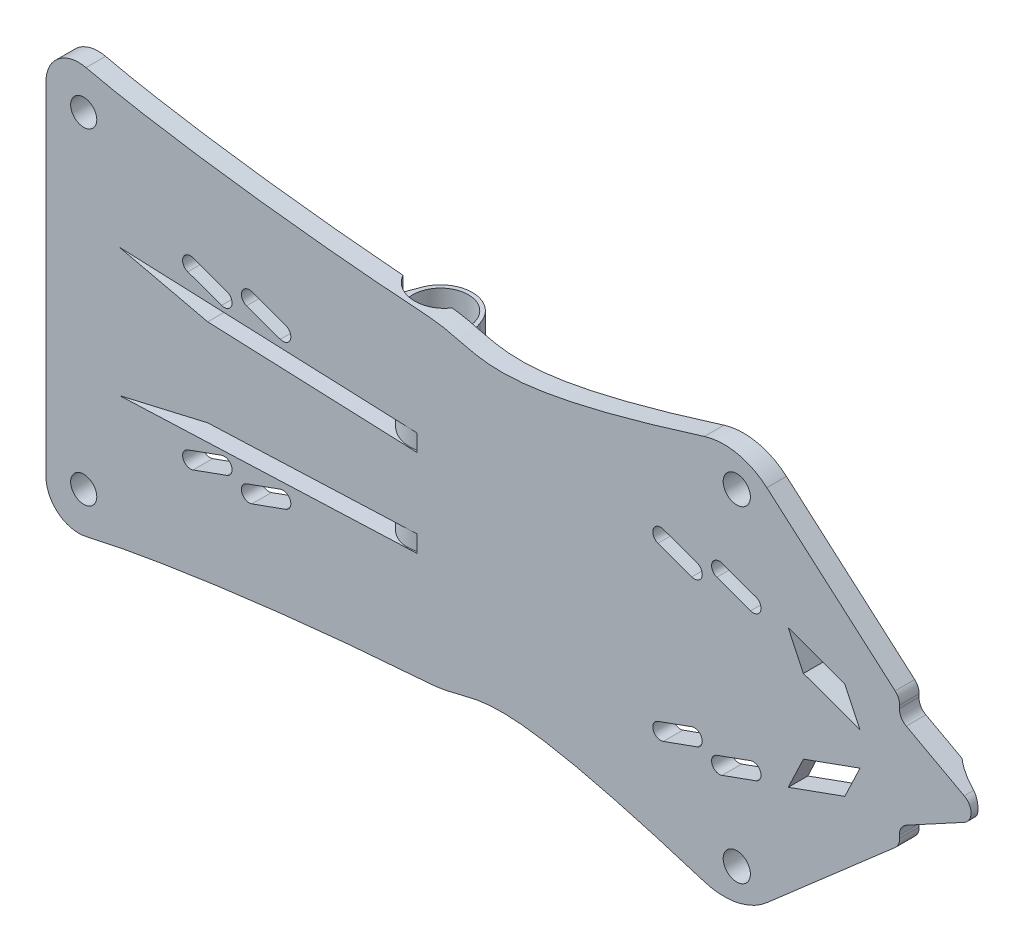
from build123d import *

# Parameters (mm, degrees)
SKETCH3_R                = 2.082096389
SKETCH3_R_2              = 2
BOSS_EXTRUDE1_DEPTH      = 3
CUT_EXTRUDE1_DEPTH       = 91.44915515
CUT_EXTRUDE3_DEPTH       = 91.44915515
CUT_EXTRUDE3_DEPTH_BACK  = 91.44915515
SKETCH8_R                = 4.25
BOSS_EXTRUDE2_DEPTH      = 1
BOSS_EXTRUDE2_DEPTH_BACK = 23
BOSS_EXTRUDE2_START      = -45
SKETCH9_R                = 5
SKETCH9_R_2              = 4.25
CHAMFER2_DEPTH           = 11.18578846
CHAMFER2_START           = -12.81421154
CHAMFER2_2_DEPTH         = 12.81421154
CHAMFER2_START_2         = -1.013840203
CHAMFER2_3_DEPTH         = 1.013840203
CUT_EXTRUDE4_DEPTH       = 91.694641904
CUT_EXTRUDE4_DEPTH_BACK  = 91.694641904
SKETCH10_R               = 4.25
SKETCH11_R               = 4.859724043
SKETCH11_R_2             = 4.25
BOSS_EXTRUDE3_DEPTH      = 21
CHAMFER3_SIZE            = 1.511790084
CUT_EXTRUDE5_DEPTH       = 103.781219255
CUT_EXTRUDE5_DEPTH_BACK  = 103.781219255
SKETCH12_R               = 4.25


with BuildPart() as part:
    # Sketch3 → Boss-Extrude1 (new body)
    with BuildSketch(Plane.XY):
        with BuildLine():
            Line((53.567335457, -27.517277185), (73.205575811, -10.388630143))
            ThreePointArc((73.205575811, -10.388630143), (73.719795761, -9.686550842), (73.883615194, -8.831857508))
            Line((73.883615194, -8.831857508), (73.869489232, -8.39082312))
            ThreePointArc((73.869489232, -8.39082312), (74.133881529, -7.331195739), (74.915488843, -6.568435304))
            Line((74.915488843, -6.568435304), (83.790693699, -1.758362323))
            ThreePointArc((83.790693699, -1.758362323), (84.837718389, 0), (83.790693699, 1.758362323))
            Line((83.790693699, 1.758362323), (74.915488843, 6.568435304))
            ThreePointArc((74.915488843, 6.568435304), (74.133881529, 7.331195739), (73.869489232, 8.39082312))
            Line((73.869489232, 8.39082312), (73.883615194, 8.831857508))
            ThreePointArc((73.883615194, 8.831857508), (73.719795761, 9.686550842), (73.205575811, 10.388630143))
            Line((73.205575811, 10.388630143), (53.567335457, 27.517277185))
            ThreePointArc((53.567335457, 27.517277185), (49.04018756, 29.769557014), (43.989927812, 29.519139381))
            add(Edge.make_bspline(
                [(43.989927812, 29.519139381), (11.417328412, 19.259455683), (10.016864662, 23.93436223), (-9.743436757, 24.953195317), (-36.823512678, 27.880918184), (-50.686624463, 31.089958986)],
                knots=[0.053265799, 0.053265799, 0.053265799, 0.053265799, 0.401148982, 0.486692618, 0.908702153, 0.908702153, 0.908702153, 0.908702153], degree=3))
            ThreePointArc((-50.686624463, 31.089958986), (-54.925647271, 30.132708588), (-56.81421154, 26.218763303))
            Line((-56.81421154, 26.218763303), (-56.81421154, -26.218763303))
            ThreePointArc((-56.81421154, -26.218763303), (-54.925647271, -30.132708588), (-50.686624463, -31.089958986))
            add(Edge.make_bspline(
                [(43.989927812, -29.519139381), (11.417328412, -19.259455683), (10.016864662, -23.93436223), (-9.743436757, -24.953195317), (-36.823512678, -27.880918184), (-50.686624463, -31.089958986)],
                knots=[0.053265799, 0.053265799, 0.053265799, 0.053265799, 0.401148982, 0.486692618, 0.908702153, 0.908702153, 0.908702153, 0.908702153], degree=3))
            ThreePointArc((43.989927812, -29.519139381), (49.04018756, -29.769557014), (53.567335457, -27.517277185))
        make_face()
        with Locations((48.961511901, -25)):
            Circle(SKETCH3_R, mode=Mode.SUBTRACT)
        with Locations((-51.038488099, -25)):
            Circle(SKETCH3_R_2, mode=Mode.SUBTRACT)
        with Locations(Location((-51.038488099, 25, 0), (0, 0, 180))):
            Circle(SKETCH3_R_2, mode=Mode.SUBTRACT)
        with Locations(Location((48.961511901, 25, 0), (0, 0, 180))):
            Circle(SKETCH3_R, mode=Mode.SUBTRACT)
    extrude(amount=BOSS_EXTRUDE1_DEPTH)

    # Sketch4 → Cut-Extrude1 (cut, through all)
    with BuildSketch(Plane(origin=(0, 0, 0), x_dir=(-1, 0, 0), z_dir=(0, 0, -1))):
        with BuildLine():
            Line((-51.884820891, 12.19457593), (-46.711815918, 14.062735331))
            ThreePointArc((-46.711815918, 14.062735331), (-45.175561872, 13.341678115), (-45.896619088, 11.80542407))
            Line((-45.896619088, 11.80542407), (-51.069624062, 9.937264669))
            ThreePointArc((-51.069624062, 9.937264669), (-52.605878107, 10.658321885), (-51.884820891, 12.19457593))
        make_face()
        with BuildLine():
            Line((-42.884820891, 12.19457593), (-37.711815918, 14.062735331))
            ThreePointArc((-37.711815918, 14.062735331), (-36.175561872, 13.341678115), (-36.896619088, 11.80542407))
            Line((-36.896619088, 11.80542407), (-42.069624062, 9.937264669))
            ThreePointArc((-42.069624062, 9.937264669), (-43.605878107, 10.658321885), (-42.884820891, 12.19457593))
        make_face()
        Polygon((0, 7.98580084), (0, 5.397184464), (32.044292121, 6.696314385), (45.586397871, 9.833950684), align=None)
        Polygon((0, -5.397184464), (32.044292121, -6.696314385), (45.586397871, -9.833950684), (0, -7.98580084), align=None)
        with BuildLine():
            Line((20.115179109, 12.19457593), (25.288184082, 14.062735331))
            ThreePointArc((25.288184082, 14.062735331), (26.824438128, 13.341678115), (26.103380912, 11.80542407))
            Line((26.103380912, 11.80542407), (20.930375938, 9.937264669))
            ThreePointArc((20.930375938, 9.937264669), (19.394121893, 10.658321885), (20.115179109, 12.19457593))
        make_face()
        with BuildLine():
            Line((29.115179109, 12.19457593), (34.288184082, 14.062735331))
            ThreePointArc((34.288184082, 14.062735331), (35.824438128, 13.341678115), (35.103380912, 11.80542407))
            Line((35.103380912, 11.80542407), (29.930375938, 9.937264669))
            ThreePointArc((29.930375938, 9.937264669), (28.394121893, 10.658321885), (29.115179109, 12.19457593))
        make_face()
        with BuildLine():
            Line((29.115179109, -12.19457593), (34.288184082, -14.062735331))
            ThreePointArc((34.288184082, -14.062735331), (35.824438128, -13.341678115), (35.103380912, -11.80542407))
            Line((35.103380912, -11.80542407), (29.930375938, -9.937264669))
            ThreePointArc((29.930375938, -9.937264669), (28.394121893, -10.658321885), (29.115179109, -12.19457593))
        make_face()
        with BuildLine():
            Line((20.115179109, -12.19457593), (25.288184082, -14.062735331))
            ThreePointArc((25.288184082, -14.062735331), (26.824438128, -13.341678115), (26.103380912, -11.80542407))
            Line((26.103380912, -11.80542407), (20.930375938, -9.937264669))
            ThreePointArc((20.930375938, -9.937264669), (19.394121893, -10.658321885), (20.115179109, -12.19457593))
        make_face()
        with BuildLine():
            Line((-42.884820891, -12.19457593), (-37.711815918, -14.062735331))
            ThreePointArc((-37.711815918, -14.062735331), (-36.175561872, -13.341678115), (-36.896619088, -11.80542407))
            Line((-36.896619088, -11.80542407), (-42.069624062, -9.937264669))
            ThreePointArc((-42.069624062, -9.937264669), (-43.605878107, -10.658321885), (-42.884820891, -12.19457593))
        make_face()
        with BuildLine():
            Line((-51.884820891, -12.19457593), (-46.711815918, -14.062735331))
            ThreePointArc((-46.711815918, -14.062735331), (-45.175561872, -13.341678115), (-45.896619088, -11.80542407))
            Line((-45.896619088, -11.80542407), (-51.069624062, -9.937264669))
            ThreePointArc((-51.069624062, -9.937264669), (-52.605878107, -10.658321885), (-51.884820891, -12.19457593))
        make_face()
        Polygon((-67.829387279, 2.551083632), (-59.169760244, 5.678388502), (-56.845099744, 10.576922623), (-65.504726778, 7.449617752), align=None)
        Polygon((-59.169760244, -5.678388502), (-56.845099744, -10.576922623), (-65.504726778, -7.449617752), (-67.829387279, -2.551083632), align=None)
    extrude(amount=-CUT_EXTRUDE1_DEPTH, mode=Mode.SUBTRACT)

    # Sketch8 → Cut-Extrude3 (cut, two sides: drawn at the far end of the back side and taken through both)
    with BuildSketch(Plane(origin=(0, 0, 0), x_dir=(0, 0, -1), z_dir=(1, 0, 0)).offset(-CUT_EXTRUDE3_DEPTH_BACK)):
        with Locations((2.312209188, 0)):
            Circle(SKETCH8_R)
    extrude(amount=CUT_EXTRUDE3_DEPTH + CUT_EXTRUDE3_DEPTH_BACK, mode=Mode.SUBTRACT)

    # Sketch9 → Boss-Extrude2 (add, two sides: drawn at the far end of the back side and taken through both)
    with BuildSketch(Plane.ZY.offset(56.81421154).offset(BOSS_EXTRUDE2_START - BOSS_EXTRUDE2_DEPTH_BACK)):
        with Locations((-2.312209188, 0)):
            Circle(SKETCH9_R)
        with Locations(Location((-2.312209188, 0, 0), (0, 0, 57.040285371))):
            Circle(SKETCH9_R_2, mode=Mode.SUBTRACT)
    extrude(amount=BOSS_EXTRUDE2_DEPTH + BOSS_EXTRUDE2_DEPTH_BACK)

    # Chamfer2: read off the stored shape, not the designer's step
    # Chamfer2 outline → Chamfer2 (add)
    with BuildSketch(Plane.YZ):
        with BuildLine():
            ThreePointArc((4.433248095, 0), (4.658527542, -0.496136189), (4.828481954, -1.013840203))
            Line((4.828481954, -1.013840203), (6.26010675, 0))
            Line((6.26010675, 0), (4.433248095, 0))
        make_face()
        with BuildLine():
            Line((-6.26010675, 0), (-4.828481954, -1.013840203))
            ThreePointArc((-4.828481954, -1.013840203), (-4.658527542, -0.496136189), (-4.433248095, 0))
            Line((-4.433248095, 0), (-6.26010675, 0))
        make_face()
    extrude(amount=CHAMFER2_DEPTH)

    # Chamfer2 2 outline → Chamfer2 2 (add)
    with BuildSketch(Plane.YZ.offset(CHAMFER2_START)):
        with BuildLine():
            ThreePointArc((4.433248095, 0), (4.658527542, -0.496136189), (4.828481954, -1.013840203))
            Line((4.828481954, -1.013840203), (6.26010675, 0))
            Line((6.26010675, 0), (4.433248095, 0))
        make_face()
        with BuildLine():
            Line((-6.26010675, 0), (-4.828481954, -1.013840203))
            ThreePointArc((-4.828481954, -1.013840203), (-4.658527542, -0.496136189), (-4.433248095, 0))
            Line((-4.433248095, 0), (-6.26010675, 0))
        make_face()
    extrude(amount=CHAMFER2_2_DEPTH)

    # Chamfer2 3 outline → Chamfer2 3 (cut)
    with BuildSketch(Plane.XY.offset(CHAMFER2_START_2)):
        Polygon((-14, 8), (-14, 5.964768195), (0, 5.397184464), (0, 8), align=None)
        Polygon((0, -5.397184464), (-14, -5.964768195), (-14, -8), (0, -8), align=None)
    extrude(amount=CHAMFER2_3_DEPTH, mode=Mode.SUBTRACT)

    # Sketch10 → Cut-Extrude4 (cut, two sides: drawn at the far end of the back side and taken through both)
    with BuildSketch(Plane(origin=(0, 0, 0), x_dir=(1, 0, 0), z_dir=(0, 1, 0)).offset(-CUT_EXTRUDE4_DEPTH_BACK)):
        with Locations(Location((-1.4, 2, 0), (0, 0, 289.233075902))):
            Circle(SKETCH10_R)
    extrude(amount=CUT_EXTRUDE4_DEPTH + CUT_EXTRUDE4_DEPTH_BACK, mode=Mode.SUBTRACT)

    # Sketch11 → Boss-Extrude3 (add, symmetric)
    with BuildSketch(Plane(origin=(0, 0, 0), x_dir=(1, 0, 0), z_dir=(0, 1, 0))):
        with Locations((-1.4, 2)):
            Circle(SKETCH11_R)
        with Locations(Location((-1.4, 2, 0), (0, 0, 331.927513064))):
            Circle(SKETCH11_R_2, mode=Mode.SUBTRACT)
    extrude(amount=BOSS_EXTRUDE3_DEPTH, both=True)

    # Chamfer3
    # the kernel refuses this chamfer: 2, 1.511790084 mm, written as the material it adds along each edge
    with BuildSketch(Plane(origin=(3.02909898, -2.527492817, 0), x_dir=(1, 0, 0), z_dir=(0, 1, 0))) as chamfer3_piece_1_section:
        with BuildLine():
            Line((CHAMFER3_SIZE, 0), (0.213833892, 3.435302101))
            ThreePointArc((0.213833892, 3.435302101), (0.423511684, 1.737154949), (0, 0))
            Line((0, 0), (CHAMFER3_SIZE, 0))
        make_face()
    chamfer3_piece_1 = extrude(amount=23.527492817, mode=Mode.PRIVATE)
    chamfer3_piece_1 = chamfer3_piece_1 - Plane(origin=(3.02909898, 0, -2.312209188), x_dir=(0, 0, -1), z_dir=(1, 0, 0)) * Cylinder(4.25, 61, mode=Mode.PRIVATE)
    add(chamfer3_piece_1)
    with BuildSketch(Plane(origin=(3.02909898, -21, 0), x_dir=(0.062125783639432115, 0, -0.9980683278248972), z_dir=(0, 1, 0))) as chamfer3_piece_2_section:
        with BuildLine():
            Line((3.441950821, 0), (CHAMFER3_SIZE * 0.0621257836336, -CHAMFER3_SIZE * 0.998068327732))
            Line((CHAMFER3_SIZE * 0.0621257836336, -CHAMFER3_SIZE * 0.998068327732), (0, 0))
            ThreePointArc((0, 0), (1.76011033, -0.314771485), (3.441950821, 0))
        make_face()
    chamfer3_piece_2 = extrude(amount=23.527492817, mode=Mode.PRIVATE)
    chamfer3_piece_2 = chamfer3_piece_2 - Plane(origin=(3.02909898, 0, -2.312209188), x_dir=(0, 0, -1), z_dir=(1, 0, 0)) * Cylinder(4.25, 61, mode=Mode.PRIVATE)
    add(chamfer3_piece_2)
    with BuildSketch(Plane(origin=(-5.82909898, -21, 0), x_dir=(-0.06212578363943492, 0, -0.998068327824897), z_dir=(0, 1, 0))) as chamfer3_piece_3_section:
        with BuildLine():
            Line((3.441950821, 0), (CHAMFER3_SIZE * 0.0621257836336, CHAMFER3_SIZE * 0.998068327732))
            Line((CHAMFER3_SIZE * 0.0621257836336, CHAMFER3_SIZE * 0.998068327732), (0, 0))
            ThreePointArc((0, 0), (1.76011033, 0.314771485), (3.441950821, 0))
        make_face()
    chamfer3_piece_3 = extrude(amount=21.565477174, mode=Mode.PRIVATE)
    chamfer3_piece_3 = split(chamfer3_piece_3, bisect_by=Plane(origin=(-6.346285735, -8.243090021, 0), z_dir=(0.0405084183735224, -0.9991791971617883, 0)), keep=Keep.TOP, mode=Mode.PRIVATE)
    add(chamfer3_piece_3)
    with BuildSketch(Plane(origin=(-5.82909898, -0.565477174, 0), x_dir=(-1, 0, 0), z_dir=(0, 1, 0))) as chamfer3_piece_4_section:
        with BuildLine():
            Line((CHAMFER3_SIZE, 0), (0.213833892, -3.435302101))
            ThreePointArc((0.213833892, -3.435302101), (0.423511684, -1.737154949), (0, 0))
            Line((0, 0), (CHAMFER3_SIZE, 0))
        make_face()
    chamfer3_piece_4 = extrude(amount=21.565477174, mode=Mode.PRIVATE)
    chamfer3_piece_4 = split(chamfer3_piece_4, bisect_by=Plane(origin=(-5.473419403, 8.207702541, 0), z_dir=(0.0405084183735224, 0.9991791971617883, 0)), keep=Keep.TOP, mode=Mode.PRIVATE)
    add(chamfer3_piece_4)

    # Sketch12 → Cut-Extrude5 (cut, two sides: drawn at the far end of the back side and taken through both)
    with BuildSketch(Plane.ZY.offset(12.81421154).offset(-CUT_EXTRUDE5_DEPTH_BACK)):
        with Locations(Location((-2.312209188, 0, 0), (0, 0, 57.040285371))):
            Circle(SKETCH12_R)
    extrude(amount=CUT_EXTRUDE5_DEPTH + CUT_EXTRUDE5_DEPTH_BACK, mode=Mode.SUBTRACT)


solid = part.part
